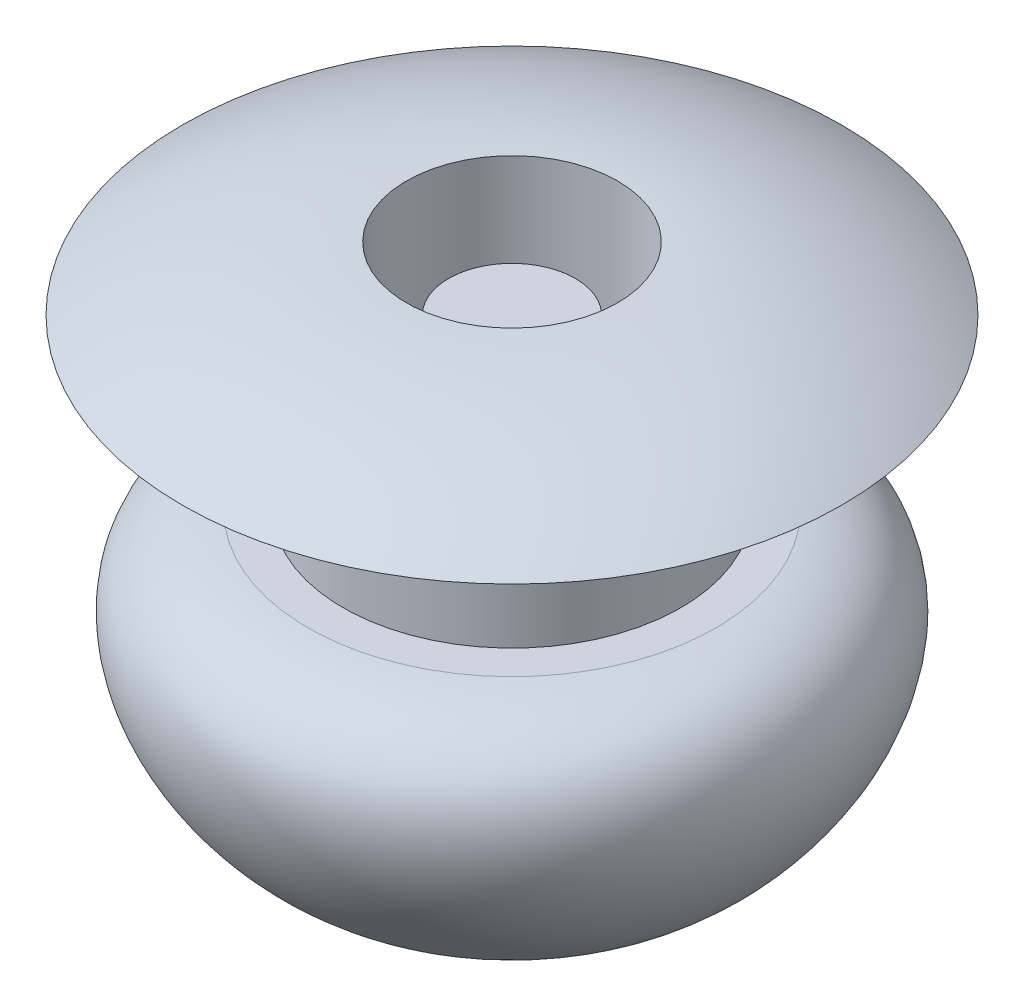
from build123d import *


with BuildPart() as part:
    # Szkic1 → Obrót1 (revolve)
    with BuildSketch(Plane(origin=(0, 0, 0), x_dir=(0, 0, -1), z_dir=(1, 0, 0))):
        with BuildLine():
            Line((0, 0), (0, -2))
            Line((0, -2), (0, -3.5))
            add(Edge.make_bspline(
                [(-0.956030427, -3.378190671), (-0.520263876, -3.5), (0, -3.5)],
                knots=[0.992852221, 0.992852221, 0.992852221, 1.570796327, 1.570796327, 1.570796327], degree=2, weights=[1, 0.958537313, 1]))
            add(Edge.make_bspline(
                [(-2.413891755, -2), (-3.858559437, -2.163296686), (-3.558358928, -4.322980362), (-0.971318098, -5.871940016), (-0.341145137, -3.79203191), (-0.956030427, -3.378190671)],
                knots=[0, 0, 0, 0, 0.454219308, 0.705200672, 1, 1, 1, 1], degree=3))
            Line((-2.413891755, -2), (-2, -2))
            Line((-2, -2), (-2, 0))
            Line((-2, 0), (-3.9, 0))
            ThreePointArc((-3.9, 0), (-2.627043935, 0.558888572), (-1.25, 0.75))
            Line((-1.25, 0.75), (-1.25, -2))
            Line((-1.25, -2), (-0.75, -2))
            Line((-0.75, -2), (-0.75, 0))
            Line((-0.75, 0), (0, 0))
        make_face()
    revolve(axis=Axis((0, 0, 0), (0, 1, 0)))


solid = part.part
